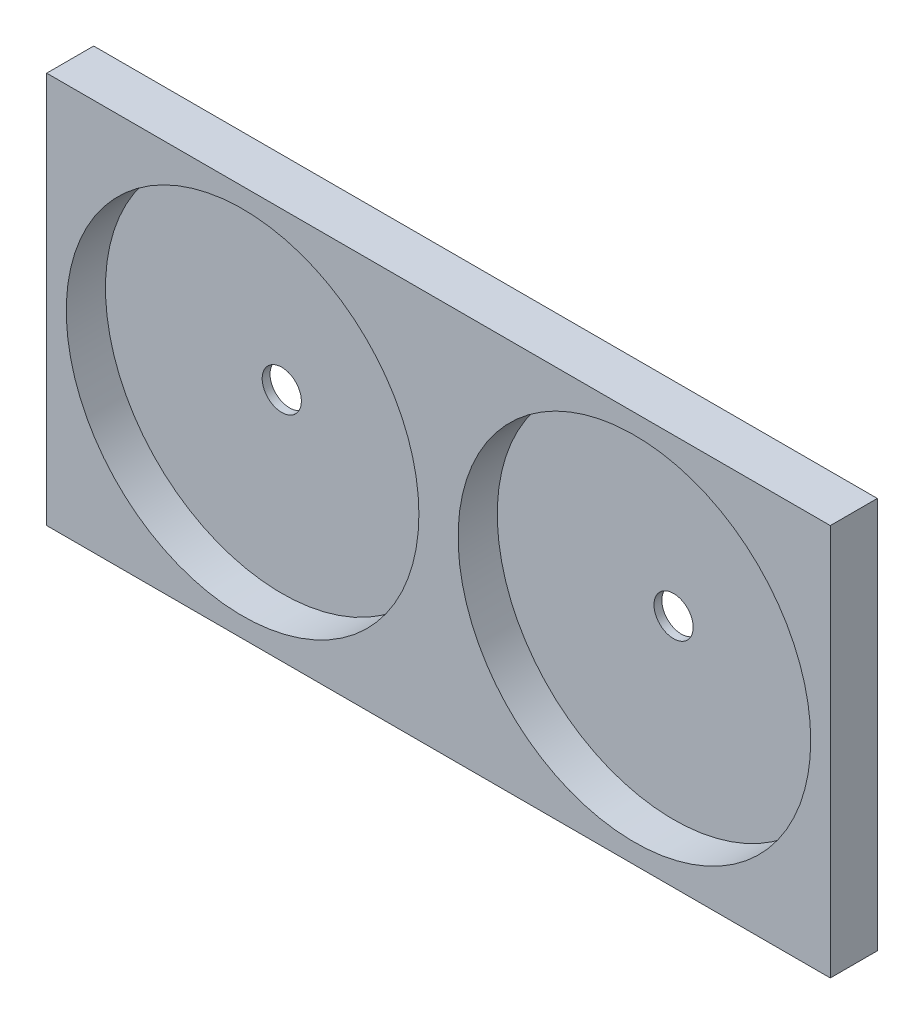
from build123d import *

# Parameters (mm, degrees)
SKETCH1_W           = 200
SKETCH1_H           = 100
BOSS_EXTRUDE1_DEPTH = 12
SKETCH2_R           = 45
CUT_EXTRUDE1_DEPTH  = 10
SKETCH3_R           = 5
CUT_EXTRUDE2_DEPTH  = 224.928560036
CUT_EXTRUDE4_DEPTH  = 1.5
CUT_EXTRUDE5_DEPTH  = 1.5


with BuildPart() as part:
    # Sketch1 → Boss-Extrude1 (new body)
    with BuildSketch(Plane.XY):
        with Locations((100, 50)):
            Rectangle(SKETCH1_W, SKETCH1_H)
    extrude(amount=BOSS_EXTRUDE1_DEPTH)

    # Sketch2 → Cut-Extrude1 (cut)
    with BuildSketch(Plane.XY.offset(12)):
        with Locations((50, 50)):
            Circle(SKETCH2_R)
        with Locations((150, 50)):
            Circle(SKETCH2_R)
    extrude(amount=-CUT_EXTRUDE1_DEPTH, mode=Mode.SUBTRACT)

    # Sketch3 → Cut-Extrude2 (cut, through all)
    with BuildSketch(Plane.XY.offset(12)):
        with Locations((50, 50)):
            Circle(SKETCH3_R)
        with Locations((150, 50)):
            Circle(SKETCH3_R)
    extrude(amount=-CUT_EXTRUDE2_DEPTH, mode=Mode.SUBTRACT)

    # Sketch4 → Cut-Extrude4 (cut)
    # profile 1 of 2: a face of its own
    with BuildSketch(Plane(origin=(0, 0, 0), x_dir=(-1, 0, 0), z_dir=(0, 0, -1))):
        with BuildLine():
            Line((-133.600331897, 55.296115572), (-133.600331897, 25.39429873))
            ThreePointArc((-133.600331897, 25.39429873), (-150, 8.994630628), (-166.399668103, 25.39429873))
            Line((-166.399668103, 25.39429873), (-166.399668103, 55.296115572))
            ThreePointArc((-166.399668103, 55.296115572), (-150, 71.695783675), (-133.600331897, 55.296115572))
        make_face()
        with BuildLine():
            Line((-141.600331897, 55.296115572), (-141.600331897, 25.39429873))
            ThreePointArc((-141.600331897, 25.39429873), (-150, 16.994630628), (-158.399668103, 25.39429873))
            Line((-158.399668103, 25.39429873), (-158.399668103, 55.296115572))
            ThreePointArc((-158.399668103, 55.296115572), (-150, 63.695783675), (-141.600331897, 55.296115572))
        make_face(mode=Mode.SUBTRACT)
    # profile 2 of 2: a face of its own
    with BuildSketch(Plane(origin=(0, 0, 0), x_dir=(-1, 0, 0), z_dir=(0, 0, -1))):
        with BuildLine():
            Line((-33.600331897, 55.296115572), (-33.600331897, 25.39429873))
            ThreePointArc((-33.600331897, 25.39429873), (-50, 8.994630628), (-66.399668103, 25.39429873))
            Line((-66.399668103, 25.39429873), (-66.399668103, 55.296115572))
            ThreePointArc((-66.399668103, 55.296115572), (-50, 71.695783675), (-33.600331897, 55.296115572))
        make_face()
        with BuildLine():
            Line((-41.600331897, 55.296115572), (-41.600331897, 25.39429873))
            ThreePointArc((-41.600331897, 25.39429873), (-50, 16.994630628), (-58.399668103, 25.39429873))
            Line((-58.399668103, 25.39429873), (-58.399668103, 55.296115572))
            ThreePointArc((-58.399668103, 55.296115572), (-50, 63.695783675), (-41.600331897, 55.296115572))
        make_face(mode=Mode.SUBTRACT)
    extrude(amount=-CUT_EXTRUDE4_DEPTH, mode=Mode.SUBTRACT)

    # Sketch5 → Cut-Extrude5 (cut)
    with BuildSketch(Plane(origin=(0, 0, 0), x_dir=(-1, 0, 0), z_dir=(0, 0, -1))):
        with BuildLine():
            Line((-110.1200005, 32.2499995), (-89.8000005, 32.2499995))
            ThreePointArc((-89.8000005, 32.2499995), (-87.8000005, 30.2499995), (-89.8000005, 28.2499995))
            Line((-89.8000005, 28.2499995), (-110.1200005, 28.2499995))
            ThreePointArc((-110.1200005, 28.2499995), (-112.1200005, 30.2499995), (-110.1200005, 32.2499995))
        make_face()
        with BuildLine():
            Line((-110.1200005, 16.9999995), (-89.8000005, 16.9999995))
            ThreePointArc((-89.8000005, 16.9999995), (-87.8000005, 14.9999995), (-89.8000005, 12.9999995))
            Line((-89.8000005, 12.9999995), (-110.1200005, 12.9999995))
            ThreePointArc((-110.1200005, 12.9999995), (-112.1200005, 14.9999995), (-110.1200005, 16.9999995))
        make_face()
    extrude(amount=-CUT_EXTRUDE5_DEPTH, mode=Mode.SUBTRACT)


solid = part.part
